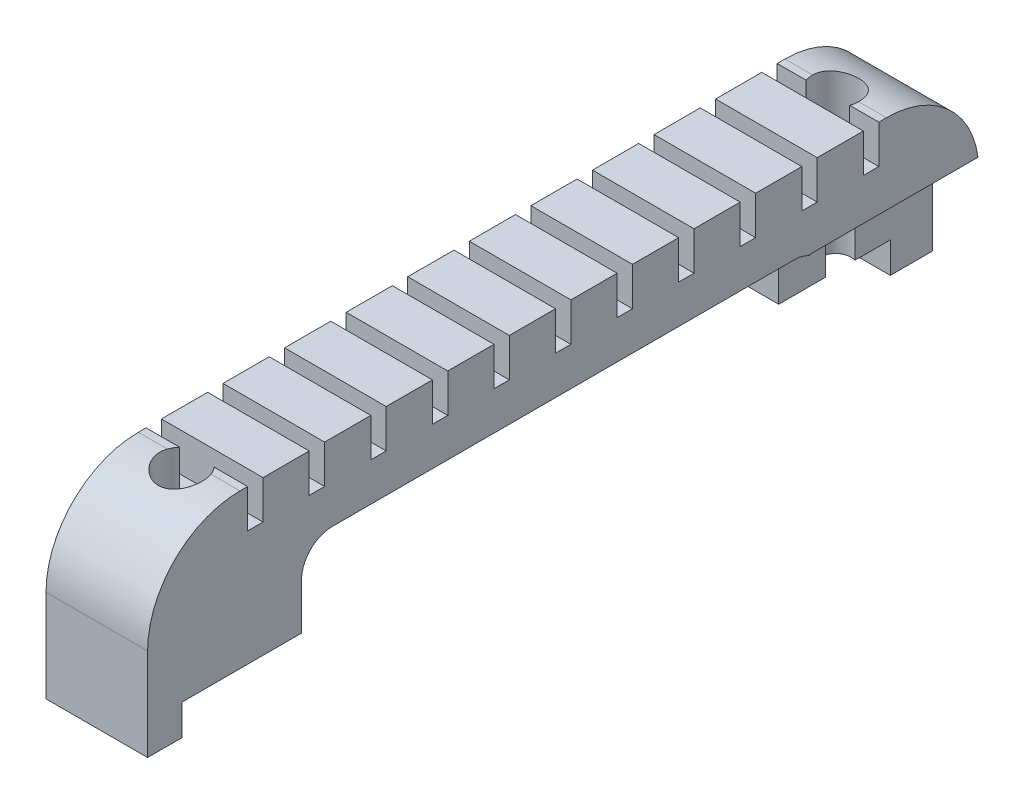
from build123d import *

# Parameters (mm, degrees)
SKETCH_1_W          = 6.6
SKETCH_1_H          = 54
SKETCH_1_R          = 1.49999954
EXTRUDE_1_DEPTH     = 12
FILLET_1_R          = 6
SKETCH_2_W          = 34
SKETCH_2_H          = 14
CUT_EXTRUDE_1_DEPTH = 20
FILLET_2_R          = 2
SKETCH_3_W          = 1
SKETCH_3_H          = 2.5
CUT_EXTRUDE_2_DEPTH = 31.274742098
SKETCH_4_W          = 14.557801868
SKETCH_4_H          = 49
CUT_EXTRUDE_3_DEPTH = 2
SKETCH_6_R          = 1.5
SKETCH_6_R_2        = 1
SKETCH_6_R_3        = 1.49999954
EXTRUDE_2_DEPTH     = 4
SKETCH_7_W          = 6
SKETCH_7_H          = 22
CUT_EXTRUDE_4_DEPTH = 6.8


with BuildPart() as part:
    # 草图1 → 凸台-拉伸1 (new body)
    with BuildSketch(Plane(origin=(0, 0, 0), x_dir=(1, 0, 0), z_dir=(0, 1, 0))):
        with Locations((-25, 0)):
            Rectangle(SKETCH_1_W, SKETCH_1_H)
        with Locations(Location((-25, -21.49999992, 0), (0, 0, 270))):
            Circle(SKETCH_1_R, mode=Mode.SUBTRACT)
        with Locations(Location((-25, 20.9999989, 0), (0, 0, 270))):
            Circle(SKETCH_1_R, mode=Mode.SUBTRACT)
    extrude(amount=EXTRUDE_1_DEPTH)

    # 圆角1
    # the kernel refuses this fillet: 6 mm, written as the material it takes off along each edge
    with BuildSketch(Plane(origin=(-6.7, 12, 27), x_dir=(0, -1, 0), z_dir=(-1, 0, 0)), Plane(origin=(-43.3, 12, -27), x_dir=(0, -1, 0), z_dir=(1, 0, 0))) as fillet_1_piece_1:
        with BuildLine():
            CenterArc((FILLET_1_R, -FILLET_1_R), FILLET_1_R, 90, 90)
            Line((0, -FILLET_1_R), (0, 0))
            Line((0, 0), (FILLET_1_R, 0))
        make_face()
    extrude(amount=36.6, mode=Mode.SUBTRACT)

    # 草图2 → 切除-拉伸1 (cut)
    with BuildSketch(Plane.ZY.offset(28.3)):
        Rectangle(SKETCH_2_W, SKETCH_2_H)
    extrude(amount=-CUT_EXTRUDE_1_DEPTH, mode=Mode.SUBTRACT)

    # 圆角2
    fillet_2_edges = [part.edges().sort_by_distance(p)[0] for p in [
        (-25, 7, 17),
        (-25, 7, -17),
    ]]
    fillet(fillet_2_edges, radius=FILLET_2_R)

    # 草图3 → 切除-拉伸2 (cut, through all)
    with BuildSketch(Plane.ZY.offset(28.3)):
        with Locations((0, 10.75)):
            Rectangle(SKETCH_3_W, SKETCH_3_H)
        with Locations((4, 10.75)):
            Rectangle(SKETCH_3_W, SKETCH_3_H)
        with Locations((8, 10.75)):
            Rectangle(SKETCH_3_W, SKETCH_3_H)
        with Locations((12, 10.75)):
            Rectangle(SKETCH_3_W, SKETCH_3_H)
        with Locations((16, 10.75)):
            Rectangle(SKETCH_3_W, SKETCH_3_H)
        with Locations((20, 10.75)):
            Rectangle(SKETCH_3_W, SKETCH_3_H)
        with Locations((-4, 10.75)):
            Rectangle(SKETCH_3_W, SKETCH_3_H)
        with Locations((-8, 10.75)):
            Rectangle(SKETCH_3_W, SKETCH_3_H)
        with Locations((-12, 10.75)):
            Rectangle(SKETCH_3_W, SKETCH_3_H)
        with Locations((-16, 10.75)):
            Rectangle(SKETCH_3_W, SKETCH_3_H)
        with Locations((-20, 10.75)):
            Rectangle(SKETCH_3_W, SKETCH_3_H)
    extrude(amount=-CUT_EXTRUDE_2_DEPTH, mode=Mode.SUBTRACT)

    # 草图4 → 切除-拉伸3 (cut)
    with BuildSketch(Plane.XZ):
        with Locations((-25, 0.25000051)):
            Rectangle(SKETCH_4_W, SKETCH_4_H)
    extrude(amount=-CUT_EXTRUDE_3_DEPTH, mode=Mode.SUBTRACT)

    # 草图6 → 凸台-拉伸2 (add)
    # profile 1 of 2: a face of its own
    with BuildSketch(Plane.XZ.offset(-2)):
        with Locations(Location((-25, 21.49999992, 0), (0, 0, 270))):
            Circle(SKETCH_6_R)
        with Locations(Location((-25, 21.49999992, 0), (0, 0, 270))):
            Circle(SKETCH_6_R_2, mode=Mode.SUBTRACT)
    # profile 2 of 2: a face of its own
    with BuildSketch(Plane.XZ.offset(-2)):
        with Locations(Location((-25, -20.9999989, 0), (0, 0, 270))):
            Circle(SKETCH_6_R_3)
        with Locations(Location((-25, -20.9999989, 0), (0, 0, 270))):
            Circle(SKETCH_6_R_2, mode=Mode.SUBTRACT)
    extrude(amount=-EXTRUDE_2_DEPTH)

    # 草图7 → 切除-拉伸4 (cut)
    with BuildSketch(Plane.XZ):
        with Locations((-21.7, -27)):
            Rectangle(SKETCH_7_W, SKETCH_7_H)
    extrude(amount=-CUT_EXTRUDE_4_DEPTH, mode=Mode.SUBTRACT)


solid = part.part
